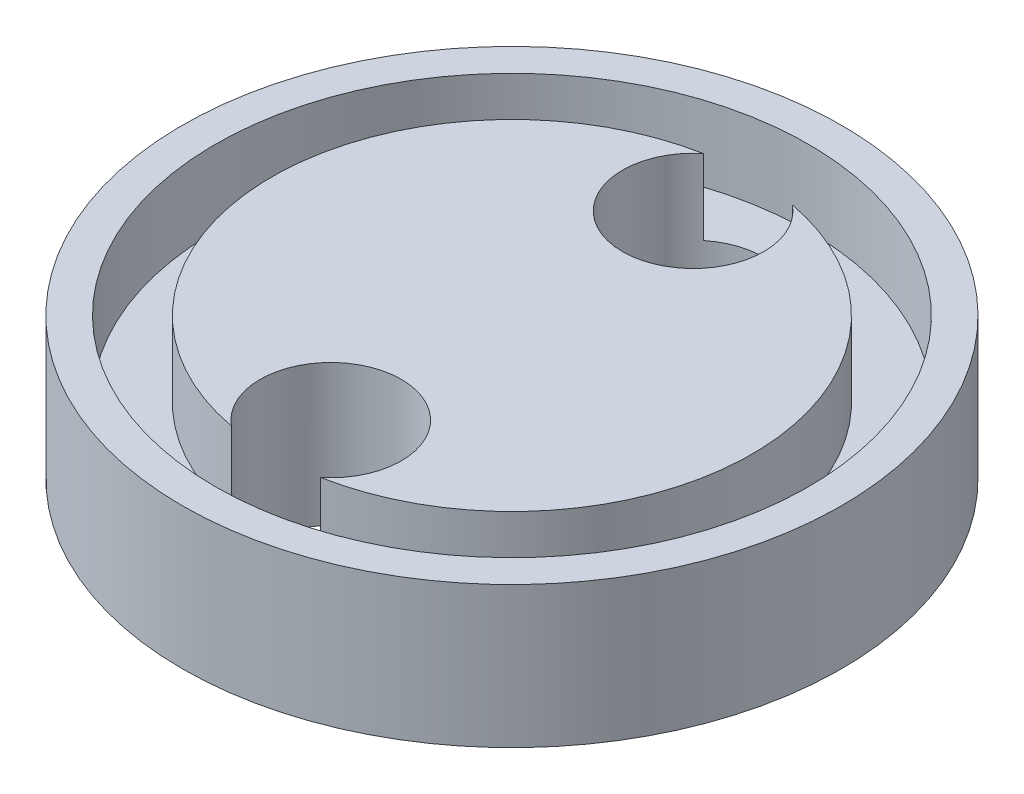
from build123d import *

# Parameters (mm, degrees)
SKETCH4_R        = 17.5
SKETCH4_R_2      = 3.75
LIDBASE_DEPTH    = 7.5
SKETCH5_R        = 15.75
SKETCH5_R_2      = 12.75
LIDGROOVES_DEPTH = 4


with BuildPart() as part:
    # Sketch4 → LidBase (new body)
    with BuildSketch(Plane(origin=(0, 0, 0), x_dir=(1, 0, 0), z_dir=(0, 1, 0))):
        Circle(SKETCH4_R)
        with Locations((0, 9.620756902)):
            Circle(SKETCH4_R_2, mode=Mode.SUBTRACT)
        with Locations((0, -9.620756902)):
            Circle(SKETCH4_R_2, mode=Mode.SUBTRACT)
    extrude(amount=LIDBASE_DEPTH)

    # Sketch5 → LidGrooves (cut)
    with BuildSketch(Plane(origin=(0, 7.5, 0), x_dir=(1, 0, 0), z_dir=(0, 1, 0))):
        Circle(SKETCH5_R)
        Circle(SKETCH5_R_2, mode=Mode.SUBTRACT)
    extrude(amount=-LIDGROOVES_DEPTH, mode=Mode.SUBTRACT)


solid = part.part
